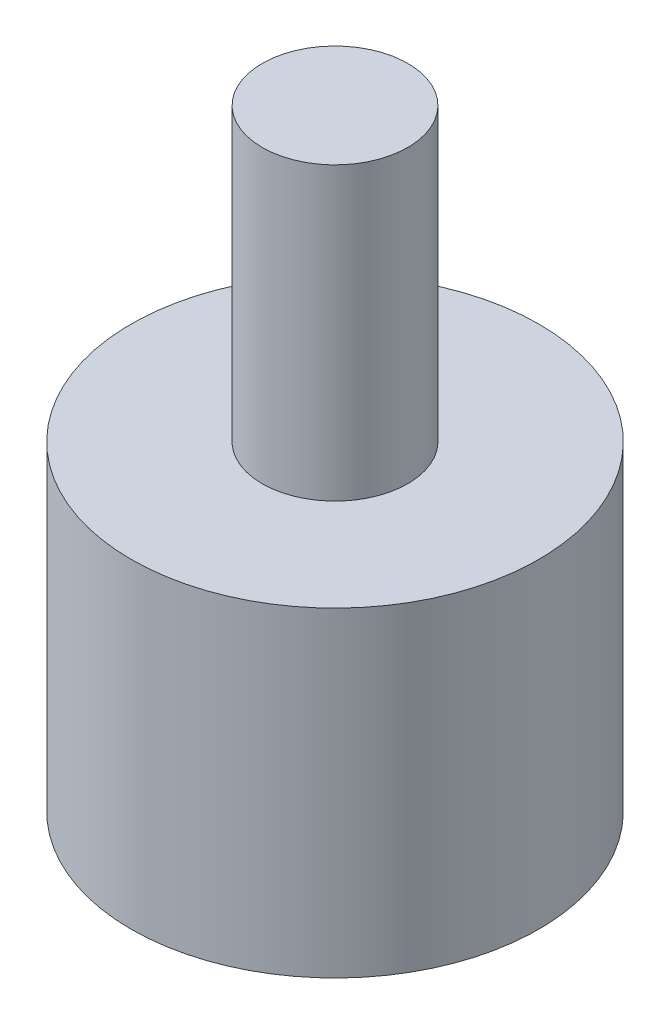
from build123d import *


with BuildPart() as part:
    # Skizze2 → Rotation1 (revolve)
    with BuildSketch(Plane(origin=(0, 0, 0), x_dir=(0, 0, -1), z_dir=(1, 0, 0))):
        Polygon((-190, 227), (-190, 212), (-187, 212), (-187, 206), (-183, 206), (-183, 217), (-187.5, 217), (-187.5, 227), align=None)
    revolve(axis=Axis((0, 227, 190), (0, -1, 0)))


solid = part.part
